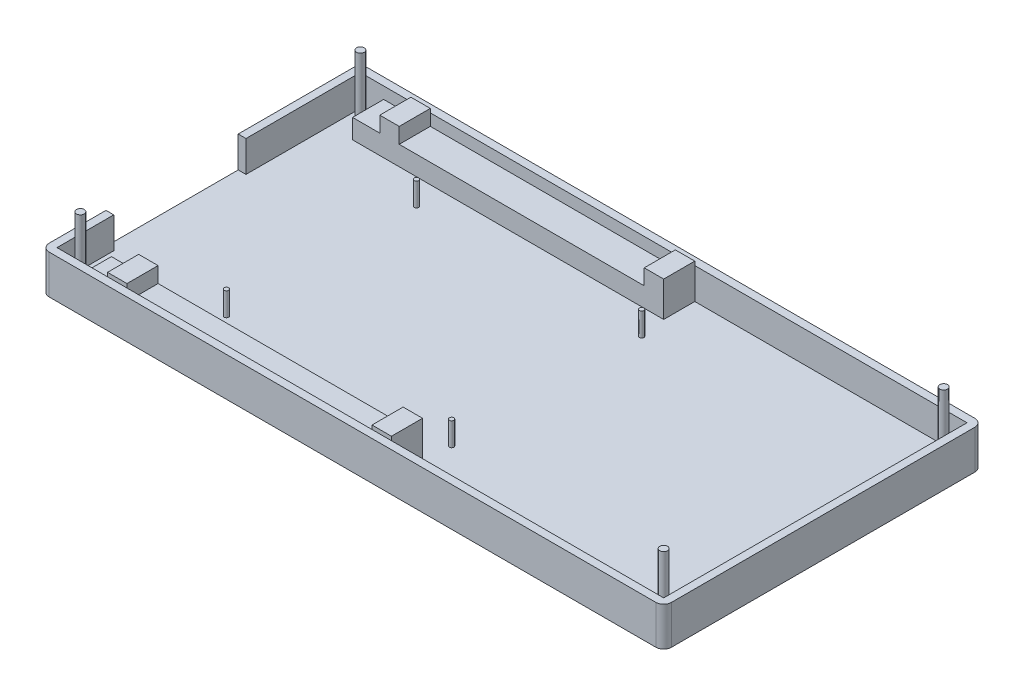
from build123d import *

# Parameters (mm, degrees)
SKETCH1_W           = 160
SKETCH1_H           = 82
BOSS_EXTRUDE1_DEPTH = 10
SHELL1_T            = -2
SKETCH2_R           = 1
BOSS_EXTRUDE2_DEPTH = 16
FILLET1_R           = 2
FILLET2_R           = 2
FILLET3_R           = 2
FILLET4_R           = 2
SKETCH7_R           = 0.575
BOSS_EXTRUDE3_DEPTH = 6
SKETCH10_W          = 34
SKETCH10_H          = 8.029729716
CUT_EXTRUDE1_DEPTH  = 6
SKETCH16_W          = 80
SKETCH16_H          = 8
BOSS_EXTRUDE5_DEPTH = 5
SKETCH18_W          = 5
SKETCH18_H          = 8
BOSS_EXTRUDE6_DEPTH = 4


with BuildPart() as part:
    # Sketch1 → Boss-Extrude1 (new body)
    with BuildSketch(Plane(origin=(0, 0, 0), x_dir=(1, 0, 0), z_dir=(0, 1, 0))):
        Rectangle(SKETCH1_W, SKETCH1_H)
    extrude(amount=BOSS_EXTRUDE1_DEPTH)

    # Shell1
    shell1_openings = [part.faces().sort_by_distance(p)[0] for p in [
        (0, 10, 0),
    ]]
    offset(amount=SHELL1_T, openings=shell1_openings, kind=Kind.INTERSECTION)

    # Sketch2 → Boss-Extrude2 (add)
    with BuildSketch(Plane(origin=(0, 2, 0), x_dir=(1, 0, 0), z_dir=(0, 1, 0))):
        with Locations((-75, 36)):
            Circle(SKETCH2_R)
        with Locations((75, 36)):
            Circle(SKETCH2_R)
        with Locations((75, -36)):
            Circle(SKETCH2_R)
        with Locations((-75, -36)):
            Circle(SKETCH2_R)
    extrude(amount=BOSS_EXTRUDE2_DEPTH)

    # Fillet1
    fillet1_edges = [part.edges().sort_by_distance(p)[0] for p in [
        (-80, 5, 41),
    ]]
    fillet(fillet1_edges, radius=FILLET1_R)

    # Fillet2
    fillet2_edges = [part.edges().sort_by_distance(p)[0] for p in [
        (-80, 5, -41),
    ]]
    fillet(fillet2_edges, radius=FILLET2_R)

    # Fillet3
    fillet3_edges = [part.edges().sort_by_distance(p)[0] for p in [
        (80, 5, -41),
    ]]
    fillet(fillet3_edges, radius=FILLET3_R)

    # Fillet4
    fillet4_edges = [part.edges().sort_by_distance(p)[0] for p in [
        (80, 5, 41),
    ]]
    fillet(fillet4_edges, radius=FILLET4_R)

    # Sketch7 → Boss-Extrude3 (add)
    with BuildSketch(Plane(origin=(0, 2, 0), x_dir=(1, 0, 0), z_dir=(0, 1, 0))):
        with Locations((-49, 24.45)):
            Circle(SKETCH7_R)
        with Locations((-49, -24.43)):
            Circle(SKETCH7_R)
        with Locations((8.9, -24.43)):
            Circle(SKETCH7_R)
        with Locations((8.9, 24.45)):
            Circle(SKETCH7_R)
    extrude(amount=BOSS_EXTRUDE3_DEPTH)

    # Sketch10 → Cut-Extrude1 (cut)
    with BuildSketch(Plane.ZY.offset(80)):
        with Locations((7.4, 6.014864858)):
            Rectangle(SKETCH10_W, SKETCH10_H)
    extrude(amount=-CUT_EXTRUDE1_DEPTH, mode=Mode.SUBTRACT)

    # Sketch16 → Boss-Extrude5 (add)
    with BuildSketch(Plane(origin=(0, 2, 0), x_dir=(1, 0, 0), z_dir=(0, 1, 0))):
        with Locations((-32, 35)):
            Rectangle(SKETCH16_W, SKETCH16_H)
        with Locations((-32, -35)):
            Rectangle(SKETCH16_W, SKETCH16_H)
    extrude(amount=BOSS_EXTRUDE5_DEPTH)

    # Sketch18 → Boss-Extrude6 (add)
    with BuildSketch(Plane(origin=(0, 7, 0), x_dir=(1, 0, 0), z_dir=(0, 1, 0))):
        with Locations((-62.5, 35)):
            Rectangle(SKETCH18_W, SKETCH18_H)
        with Locations((5.5, 35)):
            Rectangle(SKETCH18_W, SKETCH18_H)
        with Locations((5.5, -35)):
            Rectangle(SKETCH18_W, SKETCH18_H)
        with Locations((-62.5, -35)):
            Rectangle(SKETCH18_W, SKETCH18_H)
    extrude(amount=BOSS_EXTRUDE6_DEPTH)


solid = part.part
